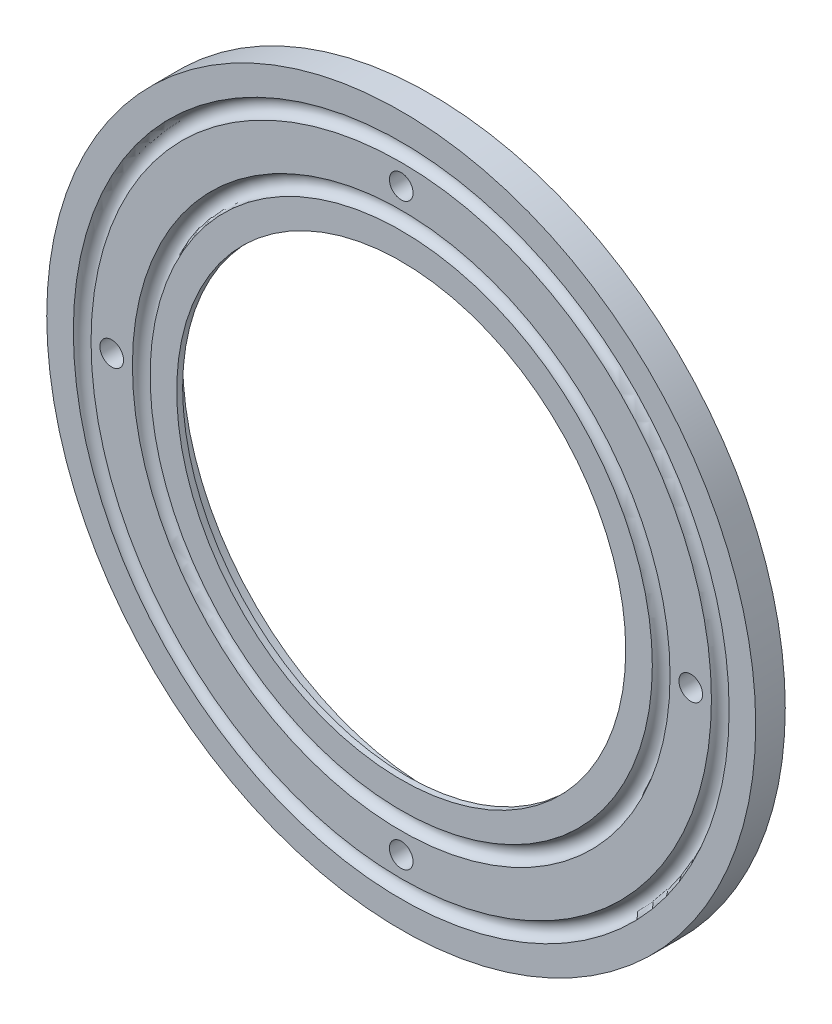
from build123d import *

# Parameters (mm, degrees)
SKETCH4_R          = 2
CUT_EXTRUDE1_DEPTH = 10
SKETCH5_R          = 42
CUT_EXTRUDE2_DEPTH = 4


with BuildPart() as part:
    # Sketch3 → Revolve1 (revolve)
    with BuildSketch(Plane(origin=(0, 0, 0), x_dir=(1, 0, 0), z_dir=(0, 1, 0))):
        with BuildLine():
            Line((60, 0), (60, 5))
            Line((60, 5), (38, 5))
            Line((38, 5), (38, 0))
            Line((38, 0), (42.5, 0))
            ThreePointArc((42.5, 0), (44, 1.5), (45.5, 0))
            Line((45.5, 0), (52.5, 0))
            ThreePointArc((52.5, 0), (54, 1.5), (55.5, 0))
            Line((55.5, 0), (60, 0))
        make_face()
    revolve(axis=Axis((0, 0, 0), (0, 0, -1)))

    # Sketch4 → Cut-Extrude1 (cut)
    with BuildSketch(Plane.XY):
        with Locations((49, 0)):
            Circle(SKETCH4_R)
        with Locations((-49, 0)):
            Circle(SKETCH4_R)
        with Locations((0, 49)):
            Circle(SKETCH4_R)
        with Locations((0, -49)):
            Circle(SKETCH4_R)
    extrude(amount=-CUT_EXTRUDE1_DEPTH, mode=Mode.SUBTRACT)

    # Sketch5 → Cut-Extrude2 (cut)
    with BuildSketch(Plane(origin=(0, 0, -5), x_dir=(-1, 0, 0), z_dir=(0, 0, -1))):
        Circle(SKETCH5_R)
    extrude(amount=-CUT_EXTRUDE2_DEPTH, mode=Mode.SUBTRACT)


solid = part.part
